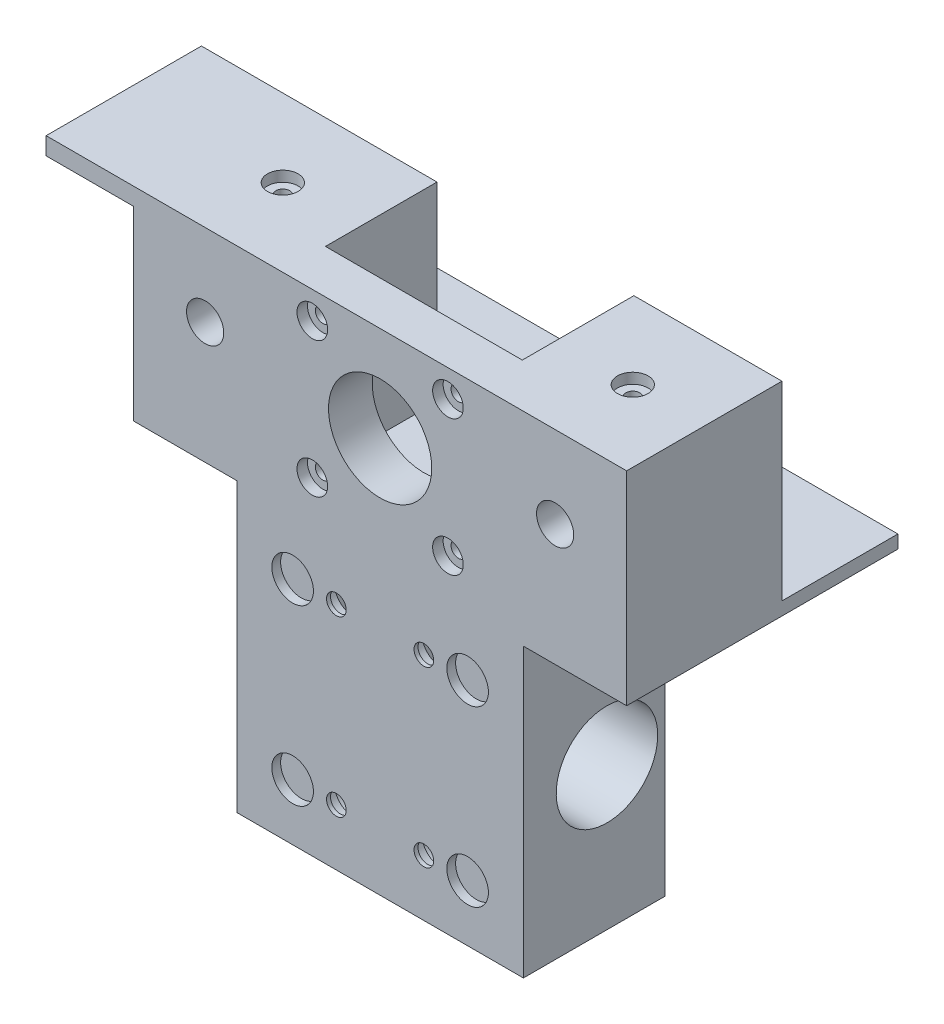
from build123d import *

# Parameters (mm, degrees)
SKETCH8_W                                        = 65.5
SKETCH8_H                                        = 65.7
BOSS_EXTRUDE6_DEPTH                              = 4
SKETCH8_3_R                                      = 4.25
BOSS_EXTRUDE7_DEPTH                              = 35.5
SKETCH8_3_W                                      = 33.85
SKETCH8_3_H                                      = 43.5
BOSS_EXTRUDE7_2_DEPTH                            = 35.5
SKETCH8_4_W                                      = 45
SKETCH8_4_H                                      = 43.5
SKETCH8_4_R                                      = 11.8
BOSS_EXTRUDE8_DEPTH                              = 10
BOSS_EXTRUDE9_DEPTH                              = 62
SKETCH8_6_W                                      = 20
SKETCH8_6_H                                      = 4
BOSS_EXTRUDE10_DEPTH                             = 35.5
CBORE_FOR_M3_PAN_HEAD_MACHINE_SCREW2_D           = 3.4
CBORE_FOR_M3_PAN_HEAD_MACHINE_SCREW2_CBORE_D     = 7
CBORE_FOR_M3_PAN_HEAD_MACHINE_SCREW2_CBORE_DEPTH = 2.4
SKETCH13_R                                       = 4.75
CUT_EXTRUDE1_DEPTH                               = 2
CBORE_FOR_M4_PAN_HEAD_MACHINE_SCREW1_D           = 4.5
CBORE_FOR_M4_PAN_HEAD_MACHINE_SCREW1_CBORE_D     = 9
CBORE_FOR_M4_PAN_HEAD_MACHINE_SCREW1_CBORE_DEPTH = 3.1
SKETCH14_W                                       = 65.5
SKETCH14_H                                       = 65.7
BOSS_EXTRUDE11_DEPTH                             = 28.4
CUT_EXTRUDE2_REACH                               = 170.332
SKETCH17_R                                       = 11.6
CUT_EXTRUDE3_REACH                               = 158.114
SKETCH19_R                                       = 5.25
CBORE_START                                      = -14.812673424
CBORE_FOR_M3_PAN_HEAD_MACHINE_SCREW3_OUT_R       = 1.6
CBORE_FOR_M3_PAN_HEAD_MACHINE_SCREW3_DEPTH       = 14.812673424
CBORE_START_2                                    = -2.4
CBORE_FOR_M3_PAN_HEAD_MACHINE_SCREW3_2_O_R       = 3.5
CBORE_FOR_M3_PAN_HEAD_MACHINE_SCREW3_2_O_R_2     = 1.6
CBORE_FOR_M3_PAN_HEAD_MACHINE_SCREW3_2_DEPTH     = 2.4


# Read off the part's stored shape, not the designer's step: CBORE for M3 Pan Head Machine Screw3
with BuildPart() as part:
    # Sketch8 → Boss-Extrude6 (new body)
    with BuildSketch(Plane.XY):
        with Locations((0, -79.35)):
            Rectangle(SKETCH8_W, SKETCH8_H)
    extrude(amount=-BOSS_EXTRUDE6_DEPTH)



with BuildPart() as body_2:
    # Sketch8<3> → Boss-Extrude7 (new body)
    with BuildSketch(Plane.XY):
        Polygon((-22.5, 0), (-56.35, 0), (-56.35, -4), (-56.35, -43.5), (-22.5, -43.5), align=None)
        with Locations((-40, -18.75)):
            Circle(SKETCH8_3_R, mode=Mode.SUBTRACT)
    extrude(amount=-BOSS_EXTRUDE7_DEPTH)



with BuildPart() as body_3:
    # Sketch8<3> → Boss-Extrude7 2 (new body)
    with BuildSketch(Plane.XY):
        with Locations((39.425, -21.75)):
            Rectangle(SKETCH8_3_W, SKETCH8_3_H)
        with Locations((40, -18.75)):
            Circle(SKETCH8_3_R, mode=Mode.SUBTRACT)
    extrude(amount=-BOSS_EXTRUDE7_2_DEPTH)


with BuildPart() as body_2_1:
    add(body_2.part)

    add(body_3.part)  # Boss-Extrude8 merges body 3
    # Sketch8<4> → Boss-Extrude8 (add)
    with BuildSketch(Plane.XY):
        with Locations((0, -21.75)):
            Rectangle(SKETCH8_4_W, SKETCH8_4_H)
        with Locations((0, -21.75)):
            Circle(SKETCH8_4_R, mode=Mode.SUBTRACT)
    extrude(amount=-BOSS_EXTRUDE8_DEPTH)


with BuildPart() as part_1:
    add(part.part)

    add(body_2_1.part)  # Boss-Extrude9 merges body 2
    # Sketch8<5> → Boss-Extrude9 (add)
    with BuildSketch(Plane.XY):
        Polygon((22.5, -43.5), (-22.5, -43.5), (-56.35, -43.5), (-56.35, -46.5), (-32.75, -46.5), (32.75, -46.5), (56.35, -46.5), (56.35, -43.5), align=None)
    extrude(amount=-BOSS_EXTRUDE9_DEPTH)

    # Sketch8<6> → Boss-Extrude10 (add)
    with BuildSketch(Plane.XY):
        with Locations((-66.35, -2)):
            Rectangle(SKETCH8_6_W, SKETCH8_6_H)
    extrude(amount=-BOSS_EXTRUDE10_DEPTH)

    # CBORE for M3 Pan Head Machine Screw2 (through all)
    with Locations(Plane(origin=(-15.5, -6.25, 0), x_dir=(1, 0, 0), z_dir=(0, 0, 1))):
        with Locations((0, 0), (31, 0), (31, -31), (0, -31)):
            CounterBoreHole(CBORE_FOR_M3_PAN_HEAD_MACHINE_SCREW2_D / 2, CBORE_FOR_M3_PAN_HEAD_MACHINE_SCREW2_CBORE_D / 2, CBORE_FOR_M3_PAN_HEAD_MACHINE_SCREW2_CBORE_DEPTH)

    # Sketch13 → Cut-Extrude1 (cut)
    with BuildSketch(Plane.XY):
        with Locations((-20, -59.6)):
            Circle(SKETCH13_R)
        with Locations((20, -99.3)):
            Circle(SKETCH13_R)
        with Locations((-20, -99.3)):
            Circle(SKETCH13_R)
        with Locations((20, -59.6)):
            Circle(SKETCH13_R)
    extrude(amount=-CUT_EXTRUDE1_DEPTH, mode=Mode.SUBTRACT)

    # CBORE for M4 Pan Head Machine Screw1 (through all)
    with Locations(Plane(origin=(10, -59.6, -4), x_dir=(-1, 0, 0), z_dir=(0, 0, -1))):
        with Locations((0, 0), (20, 0), (0, -39.7), (20, -39.7)):
            CounterBoreHole(CBORE_FOR_M4_PAN_HEAD_MACHINE_SCREW1_D / 2, CBORE_FOR_M4_PAN_HEAD_MACHINE_SCREW1_CBORE_D / 2, CBORE_FOR_M4_PAN_HEAD_MACHINE_SCREW1_CBORE_DEPTH)

    # Sketch14 → Boss-Extrude11 (add)
    with BuildSketch(Plane(origin=(0, 0, -4), x_dir=(-1, 0, 0), z_dir=(0, 0, -1))):
        with Locations((0, -79.35)):
            Rectangle(SKETCH14_W, SKETCH14_H)
        with BuildLine():
            Line((15.25, -61.65), (15.25, -97.25))
            Line((15.25, -97.25), (14.560427612, -97.25))
            ThreePointArc((14.560427612, -97.25), (14.888871959, -98.251700915), (15, -99.3))
            ThreePointArc((15, -99.3), (8.951700915, -104.188871959), (5.439572388, -97.25))
            Line((5.439572388, -97.25), (-5.439572388, -97.25))
            ThreePointArc((-5.439572388, -97.25), (-5.111128041, -98.251700915), (-5, -99.3))
            ThreePointArc((-5, -99.3), (-11.048299085, -104.188871959), (-14.560427612, -97.25))
            Line((-14.560427612, -97.25), (-15.25, -97.25))
            Line((-15.25, -97.25), (-15.25, -61.65))
            Line((-15.25, -61.65), (-14.560427612, -61.65))
            ThreePointArc((-14.560427612, -61.65), (-11.048299085, -54.711128041), (-5, -59.6))
            ThreePointArc((-5, -59.6), (-5.111128041, -60.648299085), (-5.439572388, -61.65))
            Line((-5.439572388, -61.65), (5.439572388, -61.65))
            ThreePointArc((5.439572388, -61.65), (8.951700915, -54.711128041), (15, -59.6))
            ThreePointArc((15, -59.6), (14.888871959, -60.648299085), (14.560427612, -61.65))
            Line((14.560427612, -61.65), (15.25, -61.65))
        make_face(mode=Mode.SUBTRACT)
    extrude(amount=BOSS_EXTRUDE11_DEPTH)

    # Sketch17 → Cut-Extrude2 (cut, up to next)
    with BuildSketch(Plane(origin=(32.75, 0, 0), x_dir=(0, 0, -1), z_dir=(1, 0, 0)), mode=Mode.PRIVATE) as cut_extrude2_sk1:
        with Locations(Location((19.1, -79.45, 0), (0, 0, 90))):
            Circle(SKETCH17_R)
    cut_extrude2_tool1 = extrude(cut_extrude2_sk1.sketch, amount=-CUT_EXTRUDE2_REACH, mode=Mode.PRIVATE) & part_1.part
    add(cut_extrude2_tool1.solids().sort_by_distance((32.75, -79.45, -19.1))[0], mode=Mode.SUBTRACT)

    # Sketch19 → Cut-Extrude3 (cut, up to next)
    with BuildSketch(Plane.ZY.offset(32.75), mode=Mode.PRIVATE) as cut_extrude3_sk1:
        with Locations(Location((-19.1, -79.45, 0), (0, 0, 270))):
            Circle(SKETCH19_R)
    cut_extrude3_tool1 = extrude(cut_extrude3_sk1.sketch, amount=-CUT_EXTRUDE3_REACH, mode=Mode.PRIVATE) & part_1.part
    add(cut_extrude3_tool1.solids().sort_by_distance((-32.75, -79.45, -19.1))[0], mode=Mode.SUBTRACT)

    # CBORE for M3 Pan Head Machine Screw3 out → CBORE for M3 Pan Head Machine Screw3 (cut)
    with BuildSketch(Plane(origin=(0, 0, 0), x_dir=(1, 0, 0), z_dir=(0, 1, 0)).offset(CBORE_START)):
        with Locations((-40, 17.75)):
            Circle(CBORE_FOR_M3_PAN_HEAD_MACHINE_SCREW3_OUT_R)
        with Locations((40, 17.75)):
            Circle(CBORE_FOR_M3_PAN_HEAD_MACHINE_SCREW3_OUT_R)
    extrude(amount=CBORE_FOR_M3_PAN_HEAD_MACHINE_SCREW3_DEPTH, mode=Mode.SUBTRACT)

    # CBORE for M3 Pan Head Machine Screw3 2 o → CBORE for M3 Pan Head Machine Screw3 2 (cut)
    # profile 1 of 2: a face of its own
    with BuildSketch(Plane(origin=(0, 0, 0), x_dir=(1, 0, 0), z_dir=(0, 1, 0)).offset(CBORE_START_2)):
        with Locations((-40, 17.75)):
            Circle(CBORE_FOR_M3_PAN_HEAD_MACHINE_SCREW3_2_O_R)
        with Locations((-40, 17.75)):
            Circle(CBORE_FOR_M3_PAN_HEAD_MACHINE_SCREW3_2_O_R_2, mode=Mode.SUBTRACT)
    # profile 2 of 2: a face of its own
    with BuildSketch(Plane(origin=(0, 0, 0), x_dir=(1, 0, 0), z_dir=(0, 1, 0)).offset(CBORE_START_2)):
        with Locations((40, 17.75)):
            Circle(CBORE_FOR_M3_PAN_HEAD_MACHINE_SCREW3_2_O_R)
        with Locations((40, 17.75)):
            Circle(CBORE_FOR_M3_PAN_HEAD_MACHINE_SCREW3_2_O_R_2, mode=Mode.SUBTRACT)
    extrude(amount=CBORE_FOR_M3_PAN_HEAD_MACHINE_SCREW3_2_DEPTH, mode=Mode.SUBTRACT)


solid = part_1.part
